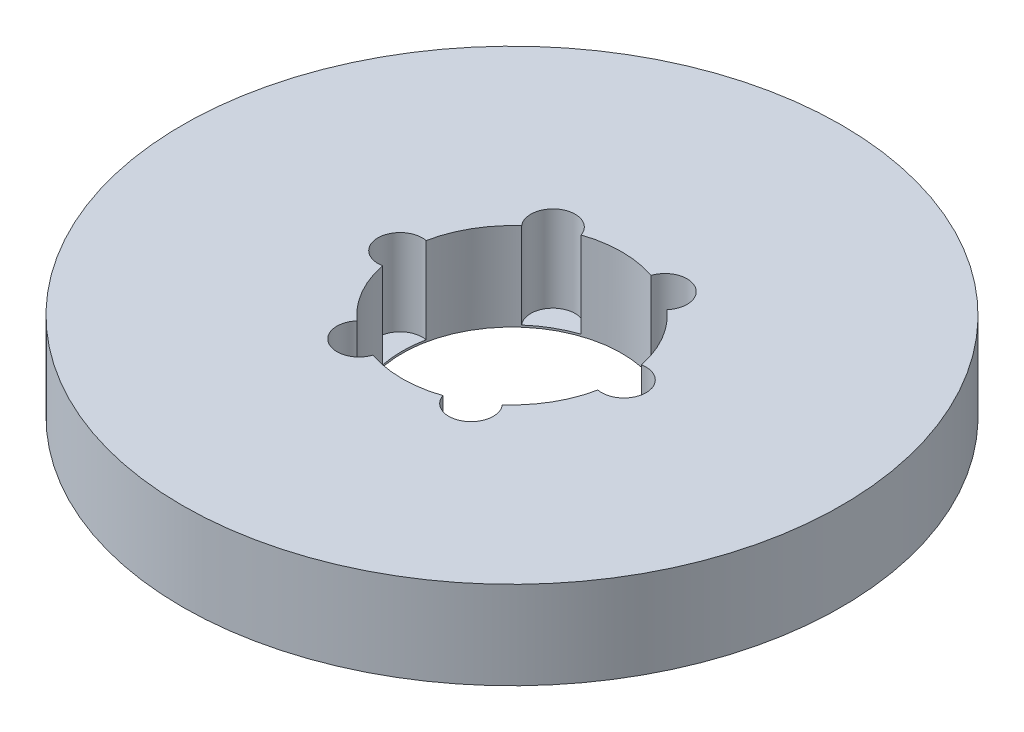
from build123d import *

# Parameters (mm, degrees)
SKETCH1_R           = 22.5
BOSS_EXTRUDE1_DEPTH = 6
SKETCH2_R           = 7.5
CUT_EXTRUDE1_DEPTH  = 33.380549717
SKETCH3_R           = 1.515311064
CUT_EXTRUDE2_DEPTH  = 5.870263411
CIRPATTERN1_COUNT   = 6


with BuildPart() as part:
    # Sketch1 → Boss-Extrude1 (new body)
    with BuildSketch(Plane(origin=(0, 0, 0), x_dir=(1, 0, 0), z_dir=(0, 1, 0))):
        Circle(SKETCH1_R)
    extrude(amount=BOSS_EXTRUDE1_DEPTH)

    # Sketch2 → Cut-Extrude1 (cut, through all)
    with BuildSketch(Plane(origin=(0, 0, 0), x_dir=(1, 0, 0), z_dir=(0, 1, 0))):
        Circle(SKETCH2_R)
    extrude(amount=CUT_EXTRUDE1_DEPTH, mode=Mode.SUBTRACT)

    # Sketch3 → Cut-Extrude2 (cut)
    with BuildSketch(Plane(origin=(0, 6, 0), x_dir=(1, 0, 0), z_dir=(0, 1, 0))):
        with Locations((-7.641021776, 0)):
            Circle(SKETCH3_R)
    cut_extrude2 = extrude(amount=-CUT_EXTRUDE2_DEPTH, mode=Mode.SUBTRACT)

    # CirPattern1: Cut-Extrude2 ×6 about axis
    cirpattern1_axis = Axis((0, 0, 0), (0, 1, 0))
    for i in range(1, CIRPATTERN1_COUNT):
        add(cut_extrude2.rotate(cirpattern1_axis, i * 360 / CIRPATTERN1_COUNT), mode=Mode.SUBTRACT)


solid = part.part
